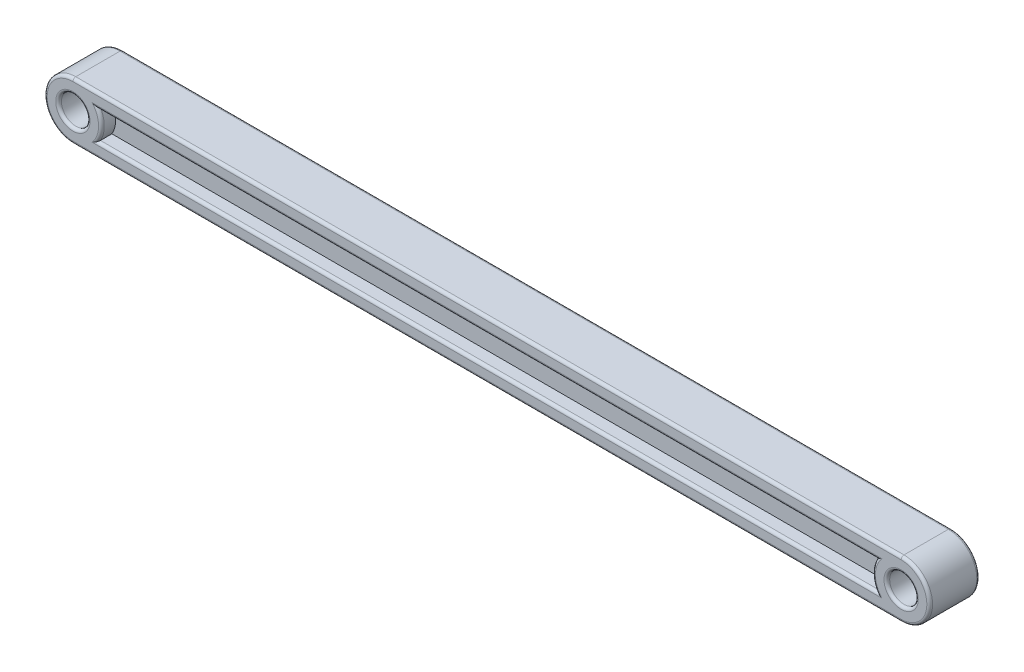
from build123d import *

# Parameters (mm, degrees)
SKETCH2_R           = 10
BOSS_EXTRUDE1_DEPTH = 17.5
CUT_EXTRUDE1_START  = -10
CUT_EXTRUDE1_DEPTH  = 10
FILLET4_R           = 2


with BuildPart() as part:
    # Sketch2 → Boss-Extrude1 (new, symmetric)
    with BuildSketch(Plane.XY):
        with BuildLine():
            Line((-290, 20), (290, 20))
            ThreePointArc((290, 20), (310, 0), (290, -20))
            Line((290, -20), (-290, -20))
            ThreePointArc((-290, -20), (-310, 0), (-290, 20))
        make_face()
        with Locations((-290, 0)):
            Circle(SKETCH2_R, mode=Mode.SUBTRACT)
        with Locations((290, 0)):
            Circle(SKETCH2_R, mode=Mode.SUBTRACT)
    extrude(amount=BOSS_EXTRUDE1_DEPTH, both=True)

    # Sketch4 → Cut-Extrude1 (cut)
    with BuildSketch(Plane(origin=(0, 0, -17.5), x_dir=(-1, 0, 0), z_dir=(0, 0, -1)).offset(CUT_EXTRUDE1_START)):
        with BuildLine():
            Line((272.679491924, 10), (-272.679491924, 10))
            ThreePointArc((-272.679491924, 10), (-270, 0), (-272.679491924, -10))
            Line((-272.679491924, -10), (272.679491924, -10))
            ThreePointArc((272.679491924, -10), (270, 0), (272.679491924, 10))
        make_face()
    cut_extrude1 = extrude(amount=CUT_EXTRUDE1_DEPTH, mode=Mode.SUBTRACT)

    # Mirror1: Cut-Extrude1 across plane
    add(cut_extrude1.mirror(Plane.XY), mode=Mode.SUBTRACT)

    # Fillet4
    fillet4_edges = [part.edges().sort_by_distance(p)[0] for p in [
        (0, 20, -17.5),
        (-310, 0, -17.5),
        (310, 0, -17.5),
        (0, -20, -17.5),
    ]]
    fillet(fillet4_edges, radius=FILLET4_R)
    fillet4_2_edges = [part.edges().sort_by_distance(p)[0] for p in [
        (0, 20, 17.5),
        (-310, 0, 17.5),
        (310, 0, 17.5),
        (0, -20, 17.5),
    ]]
    fillet(fillet4_2_edges, radius=FILLET4_R)
    fillet4_3_edges = [part.edges().sort_by_distance(p)[0] for p in [
        (280, 0, -17.5),
    ]]
    fillet(fillet4_3_edges, radius=FILLET4_R)
    fillet4_4_edges = [part.edges().sort_by_distance(p)[0] for p in [
        (0, 10, -17.5),
        (270, 0, -17.5),
        (0, -10, -17.5),
        (-270, 0, -17.5),
    ]]
    fillet(fillet4_4_edges, radius=FILLET4_R)
    fillet4_5_edges = [part.edges().sort_by_distance(p)[0] for p in [
        (-300, 0, -17.5),
    ]]
    fillet(fillet4_5_edges, radius=FILLET4_R)
    fillet4_6_edges = [part.edges().sort_by_distance(p)[0] for p in [
        (280, 0, 17.5),
    ]]
    fillet(fillet4_6_edges, radius=FILLET4_R)
    fillet4_7_edges = [part.edges().sort_by_distance(p)[0] for p in [
        (0, 10, 17.5),
        (270, 0, 17.5),
        (0, -10, 17.5),
        (-270, 0, 17.5),
    ]]
    fillet(fillet4_7_edges, radius=FILLET4_R)
    fillet4_8_edges = [part.edges().sort_by_distance(p)[0] for p in [
        (-300, 0, 17.5),
    ]]
    fillet(fillet4_8_edges, radius=FILLET4_R)


solid = part.part
